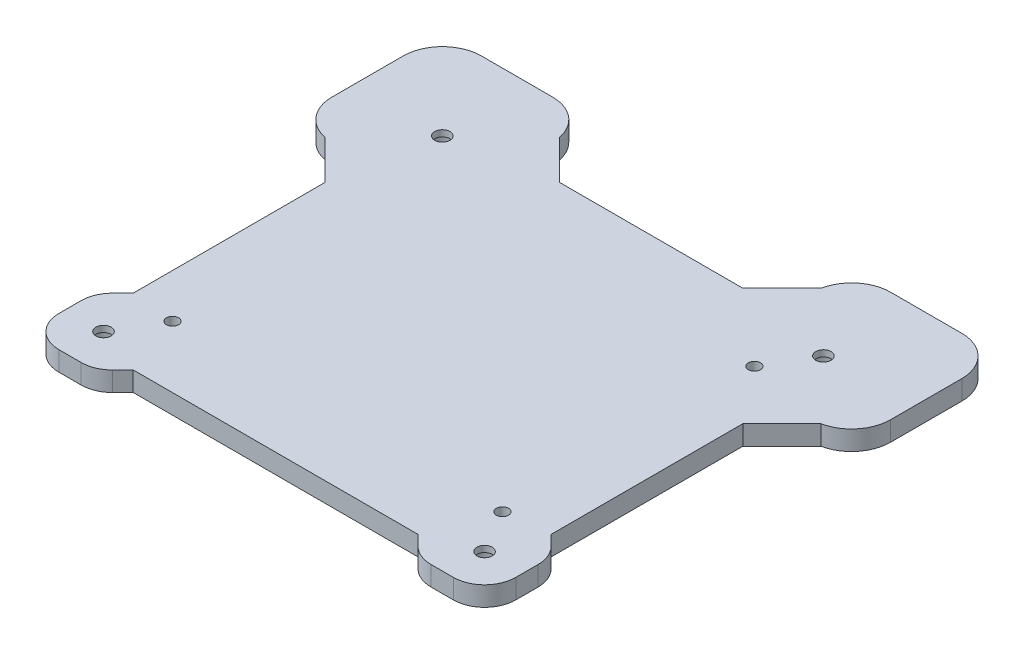
from build123d import *

# Parameters (mm, degrees)
SKETCH1_W                                       = 106.8
SKETCH1_H                                       = 96
SKETCH1_W_2                                     = 100.8
SKETCH1_H_2                                     = 90
BASE_DEPTH                                      = 5
BOSS_EXTRUDE1_DEPTH                             = 5
CHAMFER1_SIZE                                   = 10
FILLET1_R                                       = 10
CHAMFER4_SIZE                                   = 5
FILLET2_START                                   = -1
FILLET2_DEPTH                                   = 7
CBORE_FOR_M3_SOCKET_HEAD_CAP_SCREW1_D           = 3.9
CBORE_FOR_M3_SOCKET_HEAD_CAP_SCREW1_CBORE_D     = 6.8
CBORE_FOR_M3_SOCKET_HEAD_CAP_SCREW1_CBORE_DEPTH = 3.4
SKETCH8_W                                       = 20
SKETCH8_H                                       = 30
SKETCH8_W_2                                     = 40
SKETCH8_H_2                                     = 20
SKETCH8_W_3                                     = 26
SKETCH8_H_3                                     = 9.7
CUT_EXTRUDE1_DEPTH                              = 2.7
CUT_EXTRUDE2_START                              = 2.5
CUT_EXTRUDE2_OUTLINE_R                          = 1.55
CUT_EXTRUDE2_OUTLINE_R_2                        = 1.45
CUT_EXTRUDE2_DEPTH                              = 3.5
CUT_EXTRUDE3_START                              = -3.8
SKETCH9_3_R                                     = 1.45
CUT_EXTRUDE3_DEPTH                              = 3.8


with BuildPart() as part:
    # Sketch1 → Base (new body)
    # profile 1 of 2: a face of its own
    with BuildSketch(Plane(origin=(0, 0, 0), x_dir=(1, 0, 0), z_dir=(0, 1, 0))):
        Rectangle(SKETCH1_W, SKETCH1_H)
        Rectangle(SKETCH1_W_2, SKETCH1_H_2, mode=Mode.SUBTRACT)
    # profile 2 of 2: a face of its own
    with BuildSketch(Plane(origin=(0, 0, 0), x_dir=(1, 0, 0), z_dir=(0, 1, 0))):
        Rectangle(SKETCH1_W_2, SKETCH1_H_2)
    extrude(amount=BASE_DEPTH)

    # Sketch7 → Boss-Extrude1 (add)
    with BuildSketch(Plane.XZ):
        Polygon((53.4, -28), (71.4, -28), (71.4, -66), (33.4, -66), (33.4, -48), (53.4, -48), align=None)
        Polygon((-33.4, -48), (-53.4, -48), (-53.4, -28), (-71.4, -28), (-71.4, -66), (-33.4, -66), align=None)
        Polygon((-53.4, 36), (-58.4, 36), (-58.4, 53), (-41.4, 53), (-41.4, 48), (-53.4, 48), align=None)
        Polygon((41.4, 48), (53.4, 48), (53.4, 36), (58.4, 36), (58.4, 53), (41.4, 53), align=None)
    extrude(amount=-BOSS_EXTRUDE1_DEPTH)

    # Chamfer1
    chamfer1_edges = [part.edges().sort_by_distance(p)[0] for p in [
        (33.4, 2.5, -48),
        (53.4, 2.5, -28),
        (-53.4, 2.5, -28),
        (-33.4, 2.5, -48),
    ]]
    chamfer(chamfer1_edges, length=CHAMFER1_SIZE)

    # Fillet1
    # the kernel refuses this fillet: 10 mm, written as the material it takes off along each edge
    with BuildSketch(Plane(origin=(-71.4, -24.494897428, -28), x_dir=(1, 0, 0), z_dir=(0, 1, 0)), Plane(origin=(33.4, -24.494897428, -66), x_dir=(0, 0, 1), z_dir=(0, 1, 0))) as fillet1_piece_1:
        with BuildLine():
            CenterArc((10, 9.797958971), FILLET1_R, 180, 78.463040967)
            Line((0, 9.797958971), (-0.2, 9.797958971))
            Line((-0.2, 9.797958971), (-0.2, 0))
            Line((-0.2, 0), (0, -0.2))
            ThreePointArc((0, -0.2), (4, -0.2), (7.96, -0.195959179))
            Line((7.96, -0.195959179), (8, 0))
        make_face()
    extrude(amount=53.989794856, mode=Mode.SUBTRACT)
    with BuildSketch(Plane(origin=(-71.4, -25, -66), x_dir=(0, 0, 1), z_dir=(0, 1, 0)), Plane(origin=(71.4, -25, -66), x_dir=(-1, 0, 0), z_dir=(0, 1, 0))) as fillet1_piece_2:
        with BuildLine():
            CenterArc((FILLET1_R, FILLET1_R), FILLET1_R, 180, 90)
            Line((0, FILLET1_R), (-FILLET1_R * 0.02, FILLET1_R))
            Line((-FILLET1_R * 0.02, FILLET1_R), (-FILLET1_R * 0.02, -FILLET1_R * 0.02))
            Line((-FILLET1_R * 0.02, -FILLET1_R * 0.02), (FILLET1_R, -FILLET1_R * 0.02))
            Line((FILLET1_R, -FILLET1_R * 0.02), (FILLET1_R, 0))
        make_face()
    extrude(amount=55, mode=Mode.SUBTRACT)
    with BuildSketch(Plane(origin=(-33.4, -24.494897428, -66), x_dir=(-1, 0, 0), z_dir=(0, 1, 0)), Plane(origin=(71.4, -24.494897428, -28), x_dir=(0, 0, -1), z_dir=(0, 1, 0))) as fillet1_piece_3:
        with BuildLine():
            CenterArc((9.797958971, 10), FILLET1_R, 191.536959033, 78.463040967)
            Line((0, 8), (-0.195959179, 7.96))
            ThreePointArc((-0.195959179, 7.96), (-0.2, 4), (-0.2, 0))
            Line((-0.2, 0), (0, -0.2))
            Line((0, -0.2), (9.797958971, -0.2))
            Line((9.797958971, -0.2), (9.797958971, 0))
        make_face()
    extrude(amount=53.989794856, mode=Mode.SUBTRACT)

    # Chamfer4
    chamfer4_edges = [part.edges().sort_by_distance(p)[0] for p in [
        (41.4, 2.5, 48),
        (53.4, 2.5, 36),
        (-41.4, 2.5, 48),
        (-53.4, 2.5, 36),
    ]]
    chamfer(chamfer4_edges, length=CHAMFER4_SIZE - 0.0001)  # a hair under: the kernel refuses the full size

    # Fillet2: read off the stored shape, not the designer's step
    # Fillet2 outline → Fillet2 (cut)
    with BuildSketch(Plane(origin=(0, 0, 0), x_dir=(1, 0, 0), z_dir=(0, 1, 0)).offset(FILLET2_START)):
        with BuildLine():
            ThreePointArc((56.056854249, -33.656854249), (57.79103626, -36.25224104), (58.4, -39.313708499))
            Line((58.4, -39.313708499), (58.4, -36))
            Line((58.4, -36), (56.056854249, -33.656854249))
        make_face()
        with BuildLine():
            ThreePointArc((58.4, -45), (56.056854249, -50.656854249), (50.4, -53))
            Line((50.4, -53), (58.4, -53))
            Line((58.4, -53), (58.4, -45))
        make_face()
        with BuildLine():
            ThreePointArc((44.713708499, -53), (41.65224104, -52.39103626), (39.056854249, -50.656854249))
            Line((39.056854249, -50.656854249), (41.4, -53))
            Line((41.4, -53), (44.713708499, -53))
        make_face()
        with BuildLine():
            Line((-58.4, -36), (-58.4, -39.313708499))
            ThreePointArc((-58.4, -39.313708499), (-57.79103626, -36.25224104), (-56.056854249, -33.656854249))
            Line((-56.056854249, -33.656854249), (-58.4, -36))
        make_face()
        with BuildLine():
            ThreePointArc((-39.056854249, -50.656854249), (-41.65224104, -52.39103626), (-44.713708499, -53))
            Line((-44.713708499, -53), (-41.4, -53))
            Line((-41.4, -53), (-39.056854249, -50.656854249))
        make_face()
        with BuildLine():
            ThreePointArc((-50.4, -53), (-56.056854249, -50.656854249), (-58.4, -45))
            Line((-58.4, -45), (-58.4, -53))
            Line((-58.4, -53), (-50.4, -53))
        make_face()
    extrude(amount=FILLET2_DEPTH, mode=Mode.SUBTRACT)

    # CBORE for M3 Socket Head Cap Screw1 (through all)
    with Locations(Plane(origin=(0, 0, 0), x_dir=(-1, 0, 0), z_dir=(0, -1, 0))):
        with Locations((-48.7, 43.3), (-48.7, -43.3), (48.7, 43.3), (48.7, -43.3)):
            CounterBoreHole(CBORE_FOR_M3_SOCKET_HEAD_CAP_SCREW1_D / 2, CBORE_FOR_M3_SOCKET_HEAD_CAP_SCREW1_CBORE_D / 2, CBORE_FOR_M3_SOCKET_HEAD_CAP_SCREW1_CBORE_DEPTH)

    # Sketch8 → Cut-Extrude1 (cut)
    with BuildSketch(Plane.XZ):
        with Locations((-25, 10)):
            Rectangle(SKETCH8_W, SKETCH8_H)
        with Locations((25, 10)):
            Rectangle(SKETCH8_W, SKETCH8_H)
        with Locations((0, -28)):
            Rectangle(SKETCH8_W_2, SKETCH8_H_2)
        with Locations((-52.4, -55.15)):
            Rectangle(SKETCH8_W_3, SKETCH8_H_3)
        with Locations((52.4, -55.15)):
            Rectangle(SKETCH8_W_3, SKETCH8_H_3)
    extrude(amount=-CUT_EXTRUDE1_DEPTH, mode=Mode.SUBTRACT)

    # Cut-Extrude2: read off the stored shape, not the designer's step
    # Cut-Extrude2 outline → Cut-Extrude2 (cut)
    # profile 1 of 3: a face of its own
    with BuildSketch(Plane(origin=(0, 0, 0), x_dir=(1, 0, 0), z_dir=(0, 1, 0)).offset(CUT_EXTRUDE2_START)):
        with Locations((42.165, 32.2)):
            Circle(CUT_EXTRUDE2_OUTLINE_R)
        with Locations((42.165, 32.2)):
            Circle(CUT_EXTRUDE2_OUTLINE_R_2, mode=Mode.SUBTRACT)
    # profile 2 of 3: a face of its own
    with BuildSketch(Plane(origin=(0, 0, 0), x_dir=(1, 0, 0), z_dir=(0, 1, 0)).offset(CUT_EXTRUDE2_START)):
        with Locations((42.165, -32.2)):
            Circle(CUT_EXTRUDE2_OUTLINE_R)
        with Locations((42.165, -32.2)):
            Circle(CUT_EXTRUDE2_OUTLINE_R_2, mode=Mode.SUBTRACT)
    # profile 3 of 3: a face of its own
    with BuildSketch(Plane(origin=(0, 0, 0), x_dir=(1, 0, 0), z_dir=(0, 1, 0)).offset(CUT_EXTRUDE2_START)):
        with Locations((-42.165, -32.2)):
            Circle(CUT_EXTRUDE2_OUTLINE_R)
        with Locations((-42.165, -32.2)):
            Circle(CUT_EXTRUDE2_OUTLINE_R_2, mode=Mode.SUBTRACT)
    extrude(amount=CUT_EXTRUDE2_DEPTH, mode=Mode.SUBTRACT)

    # Sketch9<3> → Cut-Extrude3 (cut)
    with BuildSketch(Plane(origin=(0, 5, 0), x_dir=(1, 0, 0), z_dir=(0, 1, 0)).offset(CUT_EXTRUDE3_START)):
        with Locations(Location((-42.165, -32.2, 0), (0, 0, 270))):
            Circle(SKETCH9_3_R)
        with Locations(Location((42.165, -32.2, 0), (0, 0, 270))):
            Circle(SKETCH9_3_R)
        with Locations(Location((42.165, 32.2, 0), (0, 0, 270))):
            Circle(SKETCH9_3_R)
    extrude(amount=CUT_EXTRUDE3_DEPTH, mode=Mode.SUBTRACT)


solid = part.part
